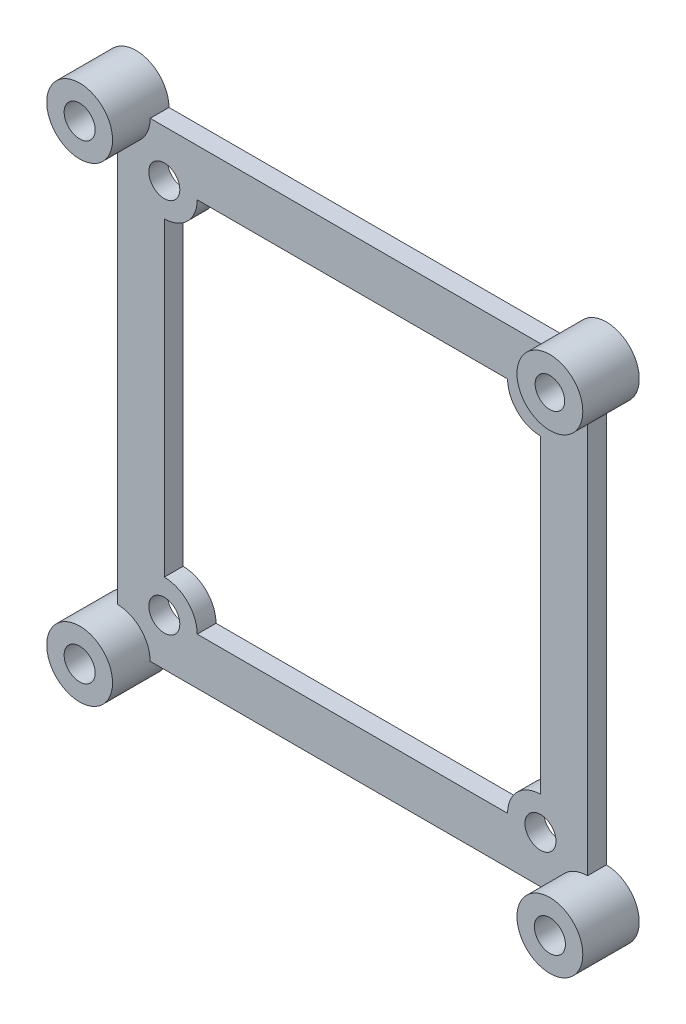
from build123d import *
from build123d.topology import SkipClean

# Parameters (mm, degrees)
SKETCH1_R           = 1.65
BOSS_EXTRUDE1_DEPTH = 2
SKETCH2_R           = 3.5
SKETCH2_R_2         = 1.65
SKETCH2_R_3         = 1.570665428
BOSS_EXTRUDE2_DEPTH = 4


with BuildPart() as part:
    # Sketch1 → Boss-Extrude1 (new body)
    with BuildSketch(Plane.XY):
        with BuildLine():
            Line((-21.5, 25), (21.5, 25))
            ThreePointArc((21.5, 25), (27.474873734, 27.474873734), (25, 21.5))
            Line((25, 21.5), (25, -21.5))
            ThreePointArc((25, -21.5), (27.474873734, -27.474873734), (21.5, -25))
            Line((21.5, -25), (-21.5, -25))
            ThreePointArc((-21.5, -25), (-27.474873734, -27.474873734), (-25, -21.5))
            Line((-25, -21.5), (-25, 21.5))
            ThreePointArc((-25, 21.5), (-27.474873734, 27.474873734), (-21.5, 25))
        make_face()
        with Locations((-20, 20)):
            Circle(SKETCH1_R, mode=Mode.SUBTRACT)
        with Locations((-25, 25)):
            Circle(SKETCH1_R, mode=Mode.SUBTRACT)
        with Locations((20, 20)):
            Circle(SKETCH1_R, mode=Mode.SUBTRACT)
        with Locations((25, 25)):
            Circle(SKETCH1_R, mode=Mode.SUBTRACT)
        with Locations((25, -25)):
            Circle(SKETCH1_R, mode=Mode.SUBTRACT)
        with Locations((20, -20)):
            Circle(SKETCH1_R, mode=Mode.SUBTRACT)
        with Locations((-20, -20)):
            Circle(SKETCH1_R, mode=Mode.SUBTRACT)
        with Locations((-25, -25)):
            Circle(SKETCH1_R, mode=Mode.SUBTRACT)
        with BuildLine():
            Line((-16.5, 20), (16.5, 20))
            ThreePointArc((16.5, 20), (17.525126266, 17.525126266), (20, 16.5))
            Line((20, 16.5), (20, -16.5))
            ThreePointArc((20, -16.5), (17.525126266, -17.525126266), (16.5, -20))
            Line((16.5, -20), (-16.5, -20))
            ThreePointArc((-16.5, -20), (-17.525126266, -17.525126266), (-20, -16.5))
            Line((-20, -16.5), (-20, 16.5))
            ThreePointArc((-20, 16.5), (-17.525126266, 17.525126266), (-16.5, 20))
        make_face(mode=Mode.SUBTRACT)
    extrude(amount=BOSS_EXTRUDE1_DEPTH)

    # Sketch2 → Boss-Extrude2 (add)
    # profile 1 of 4: a face of its own
    with SkipClean():  # the faces are left unmerged after this step: merging them gives an invalid solid
        with BuildSketch(Plane.XY.offset(2)):
            with Locations((-25, 25)):
                Circle(SKETCH2_R)
            with Locations((-25, 25)):
                Circle(SKETCH2_R_2, mode=Mode.SUBTRACT)
        # profile 2 of 4: a face of its own
        with BuildSketch(Plane.XY.offset(2)):
            with Locations((25, 25)):
                Circle(SKETCH2_R)
            with Locations((25, 25)):
                Circle(SKETCH2_R_3, mode=Mode.SUBTRACT)
        # profile 3 of 4: a face of its own
        with BuildSketch(Plane.XY.offset(2)):
            with Locations((-25, -25)):
                Circle(SKETCH2_R)
            with Locations((-25, -25)):
                Circle(SKETCH2_R_2, mode=Mode.SUBTRACT)
        # profile 4 of 4: a face of its own
        with BuildSketch(Plane.XY.offset(2)):
            with Locations((25, -25)):
                Circle(SKETCH2_R)
            with Locations((25, -25)):
                Circle(SKETCH2_R_2, mode=Mode.SUBTRACT)
        extrude(amount=BOSS_EXTRUDE2_DEPTH)


solid = part.part
